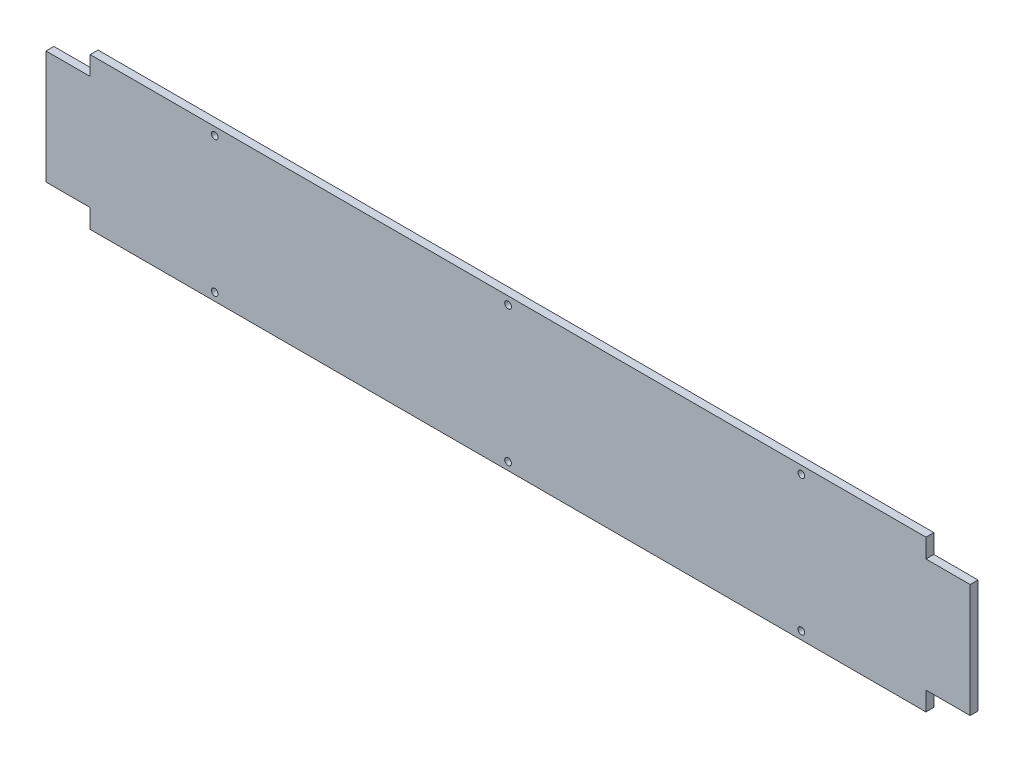
from build123d import *

# Parameters (mm, degrees)
SKETCH1_W           = 530
SKETCH1_H           = 96
BOSS_EXTRUDE1_DEPTH = 5
SKETCH2_R           = 2.125
CUT_EXTRUDE1_DEPTH  = 5
SKETCH3_W           = 28
SKETCH3_H           = 72
BOSS_EXTRUDE2_DEPTH = 5


with BuildPart() as part:
    # Sketch1 → Boss-Extrude1 (new body)
    with BuildSketch(Plane.XY):
        with Locations((265, 48)):
            Rectangle(SKETCH1_W, SKETCH1_H)
    extrude(amount=BOSS_EXTRUDE1_DEPTH)

    # Sketch2 → Cut-Extrude1 (cut)
    with BuildSketch(Plane.XY.offset(5)):
        with Locations((79, 91)):
            Circle(SKETCH2_R)
        with Locations((265, 91)):
            Circle(SKETCH2_R)
        with Locations((451, 91)):
            Circle(SKETCH2_R)
        with Locations((451, 5)):
            Circle(SKETCH2_R)
        with Locations((265, 5)):
            Circle(SKETCH2_R)
        with Locations((79, 5)):
            Circle(SKETCH2_R)
    extrude(amount=-CUT_EXTRUDE1_DEPTH, mode=Mode.SUBTRACT)

    # Sketch3 → Boss-Extrude2 (add)
    with BuildSketch(Plane.XY.offset(5)):
        with Locations((544, 48)):
            Rectangle(SKETCH3_W, SKETCH3_H)
        with Locations((-14, 48)):
            Rectangle(SKETCH3_W, SKETCH3_H)
    extrude(amount=-BOSS_EXTRUDE2_DEPTH)


solid = part.part
